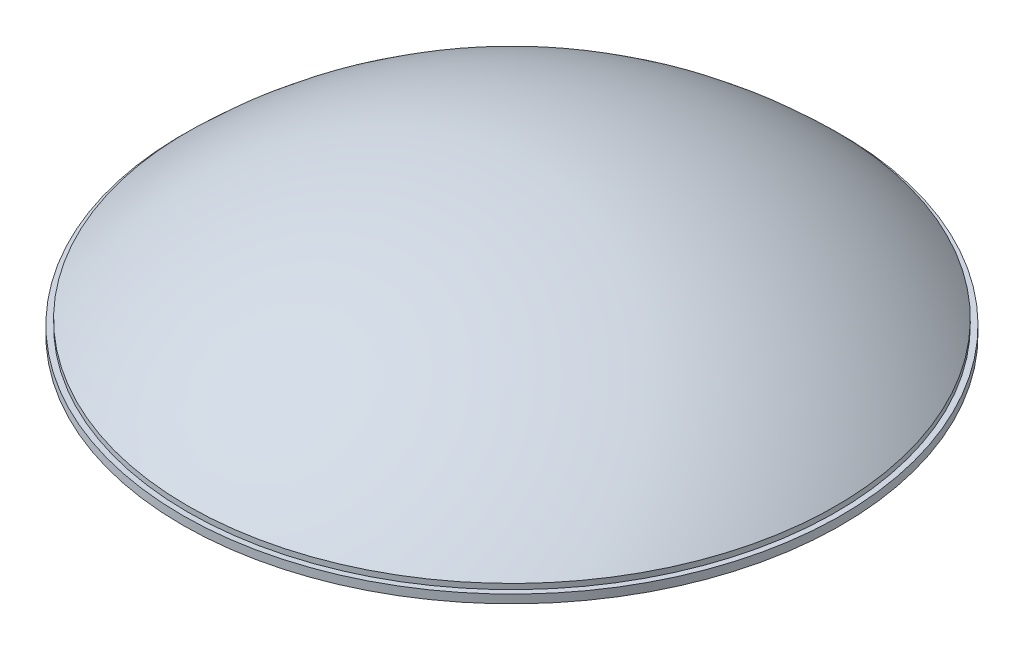
from build123d import *


with BuildPart() as part:
    # Sketch2 → Revolve1 (revolve)
    with BuildSketch(Plane(origin=(0, 0, 0), x_dir=(0, 0, -1), z_dir=(1, 0, 0))):
        with BuildLine():
            Line((242.5, 236.958329575), (242.5, 241.159179796))
            Line((242.5, 241.159179796), (238.5, 241.159179796))
            Line((238.5, 241.159179796), (238.5, 245.115788965))
            ThreePointArc((238.5, 245.115788965), (128.713635979, 316.854540622), (0, 342))
            Line((0, 342), (0, 332))
            ThreePointArc((0, 332), (126.922374282, 306.781210159), (234.562648062, 234.9560898))
            Line((234.562648062, 234.9560898), (242.5, 234.9560898))
            Line((242.5, 234.9560898), (242.5, 236.958329575))
        make_face()
    revolve(axis=Axis((0, 342, 0), (0, -1, 0)))


solid = part.part
